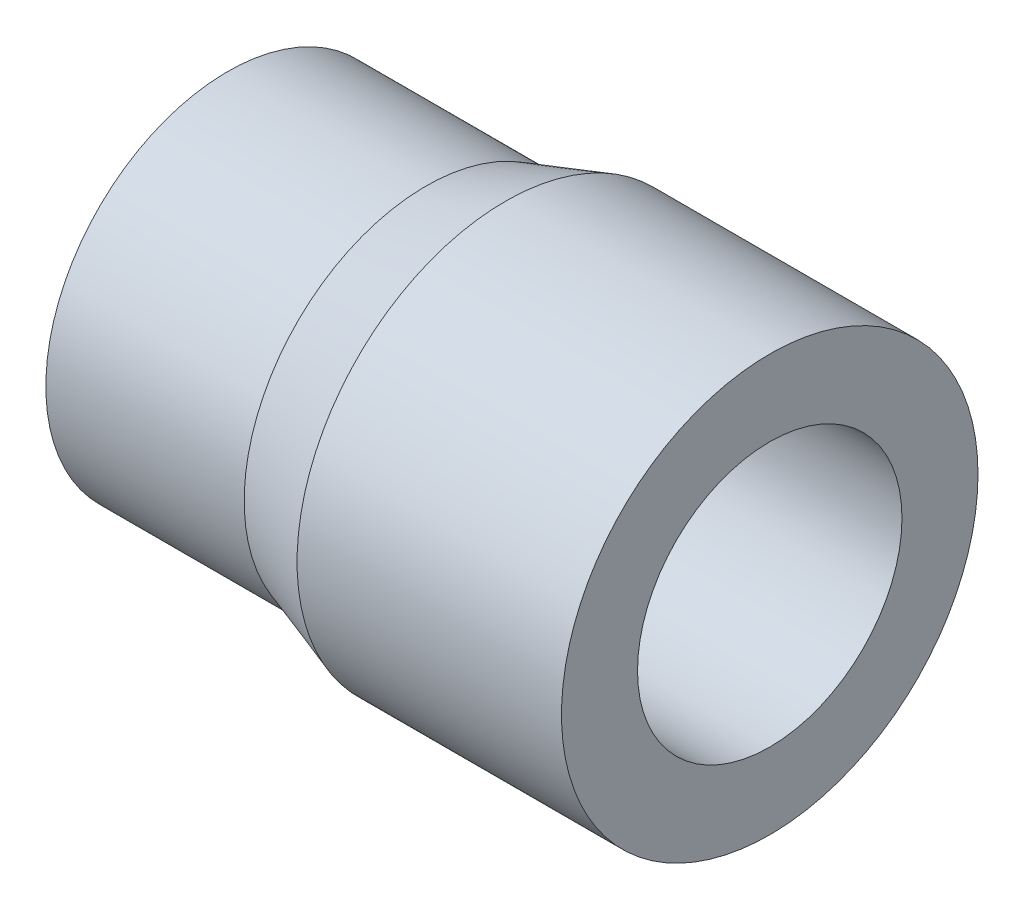
from build123d import *


with BuildPart() as part:
    # Croquis1 → Revolución1 (revolve)
    with BuildSketch(Plane(origin=(0, 0, 0), x_dir=(-1, 0, 0), z_dir=(0, 1, 0))):
        Polygon((0, 3.15), (0, 2), (8.2, 2), (8.2, 2.75), (5.2, 2.75), (4, 3.15), align=None)
    revolve(axis=Axis((0, 0, 0), (-1, 0, 0)))


solid = part.part
